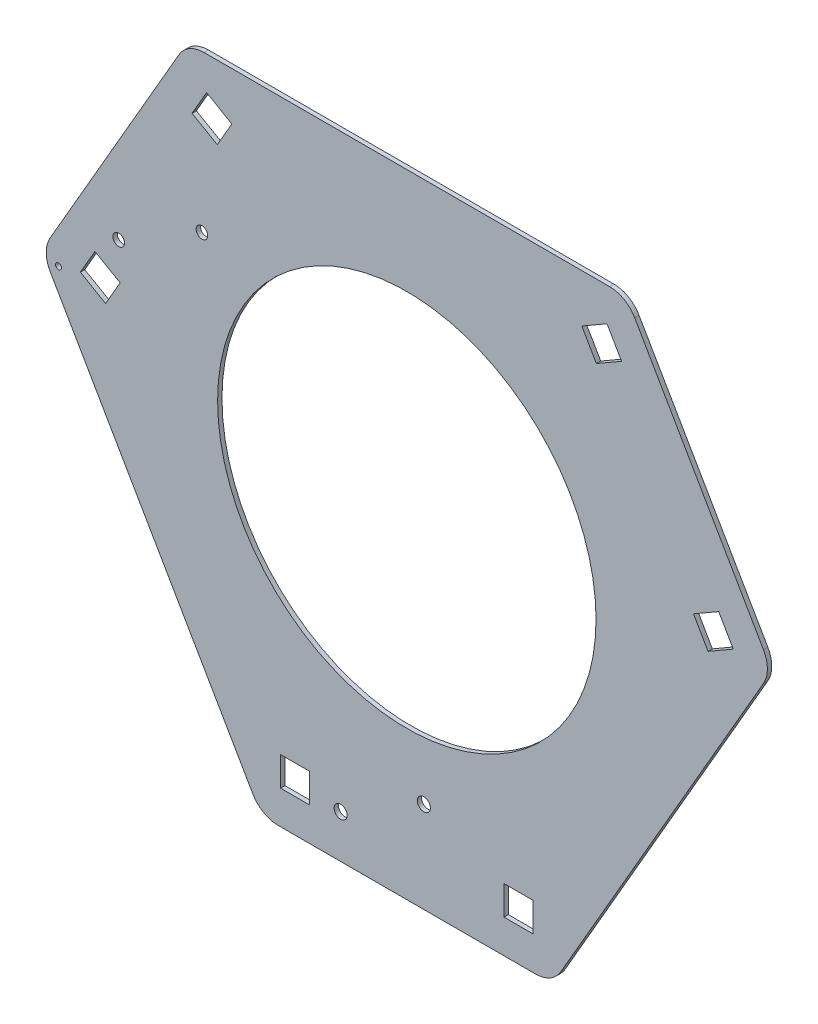
from build123d import *

# Parameters (mm, degrees)
SKETCH_1_R          = 4.5
SKETCH_1_R_2        = 2
SKETCH_1_R_3        = 4
EXTRUDE_1_DEPTH     = 3
SKETCH_8_W          = 20
SKETCH_8_H          = 20
CUT_EXTRUDE_4_DEPTH = 342.614056427
FILLET_2_R          = 20


with BuildPart() as part:
    # 草图1 → 凸台-拉伸1 (new body)
    with BuildSketch(Plane.XY):
        Polygon((250.828607906, 29.345910457), (150.828607906, 202.550991214), (-150.828607906, 202.550991214), (-250.828607906, 29.345910457), (-175.414303953, -101.275495607), (-100, -231.89690167), (100, -231.89690167), align=None)
        with Locations((-45.474536031, -202.295632426)):
            Circle(SKETCH_1_R, mode=Mode.SUBTRACT)
        with Locations((11.683140619, -169.295632426)):
            Circle(SKETCH_1_R, mode=Mode.SUBTRACT)
        with Locations((-239.296511553, 25.319478934)):
            Circle(SKETCH_1_R_2, mode=Mode.SUBTRACT)
        with Locations((-197.930424771, 61.765712785)):
            Circle(SKETCH_1_R_3, mode=Mode.SUBTRACT)
        with Locations((-140.772748121, 94.765712785)):
            Circle(SKETCH_1_R_3, mode=Mode.SUBTRACT)
        with BuildLine():
            ThreePointArc((-112.583302492, -65), (-65, 112.583302492), (112.583302492, 65))
            ThreePointArc((112.583302492, 65), (65, -112.583302492), (-112.583302492, -65))
        make_face(mode=Mode.SUBTRACT)
    extrude(amount=EXTRUDE_1_DEPTH)

    # 草图8 → 切除-拉伸4 (cut, through all)
    with BuildSketch(Plane.XY.offset(3)):
        Polygon((-137.549551714, 179.550991214), (-147.549551714, 162.230483138), (-130.229043638, 152.230483138), (-120.229043638, 169.550991214), align=None)
        Polygon((-214.270495523, 46.666418532), (-224.270495523, 29.345910457), (-206.949987447, 19.345910457), (-196.949987447, 36.666418532), align=None)
        with Locations((-76.720943809, -198.89690167)):
            Rectangle(SKETCH_8_W, SKETCH_8_H)
        with Locations((76.720943809, -198.89690167)):
            Rectangle(SKETCH_8_W, SKETCH_8_H)
        Polygon((224.270495523, 29.345910457), (214.270495523, 46.666418532), (196.949987447, 36.666418532), (206.949987447, 19.345910457), align=None)
        Polygon((137.549551714, 179.550991214), (147.549551714, 162.230483138), (130.229043638, 152.230483138), (120.229043638, 169.550991214), align=None)
    extrude(amount=-CUT_EXTRUDE_4_DEPTH, mode=Mode.SUBTRACT)

    # 圆角2
    fillet_2_edges = [part.edges().sort_by_distance(p)[0] for p in [
        (100, -231.89690167, 1.5),
        (-100, -231.89690167, 1.5),
        (150.828607906, 202.550991214, 1.5),
        (250.828607906, 29.345910457, 1.5),
        (-250.828607906, 29.345910457, 1.5),
        (-150.828607906, 202.550991214, 1.5),
    ]]
    fillet(fillet_2_edges, radius=FILLET_2_R)


solid = part.part
